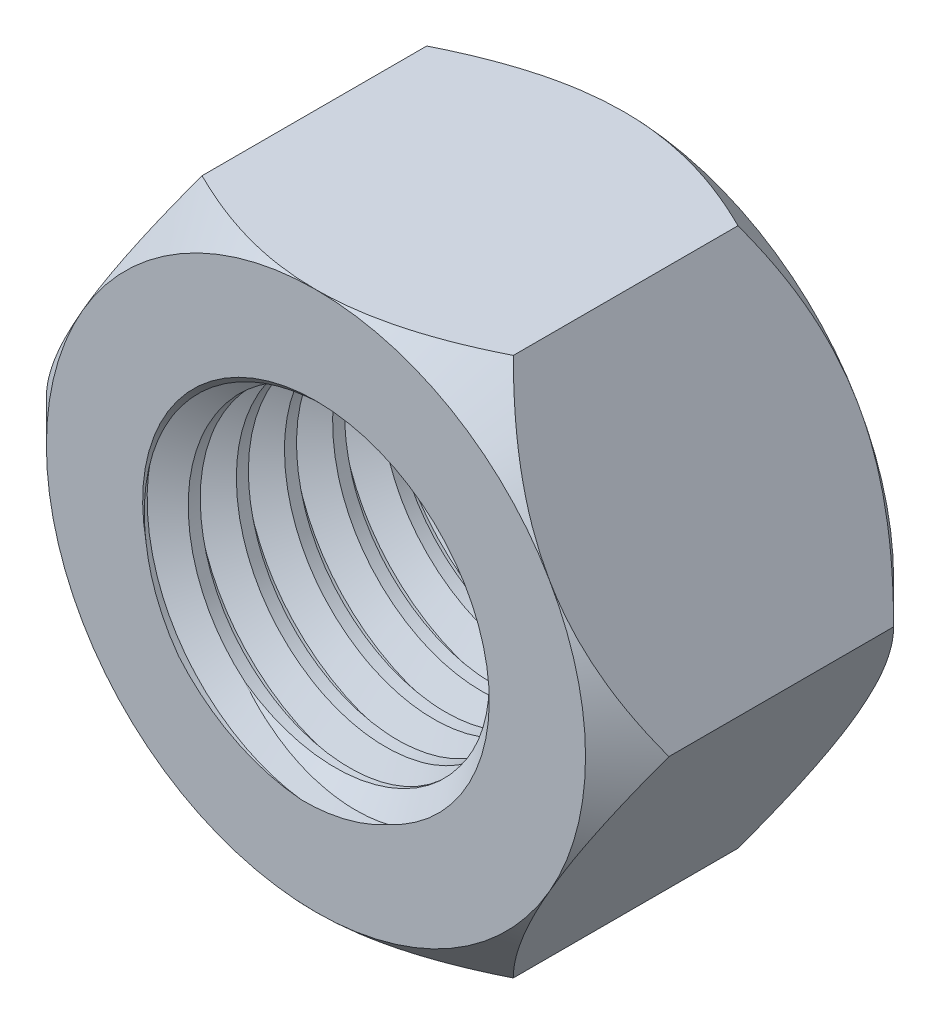
from build123d import *

# Parameters (mm, degrees)
BOSS_EXTRUDE1_DEPTH     = 4
SKETCH2_OUTSIDE_W       = 51.44
SKETCH2_OUTSIDE_H       = 49.274
SKETCH2_OUTSIDE_R       = 7
CUT_EXTRUDE1_DEPTH      = 14.354150416
CUT_EXTRUDE1_DRAFT      = -45
MIRROR1_COPY_1_SKETCH_W = 51.44
MIRROR1_COPY_1_SKETCH_H = 49.274
MIRROR1_COPY_1_SKETCH_R = 7
MIRROR1_COPY_1_DEPTH    = 14.354150416
MIRROR1_COPY_1_DRAFT    = -45
SKETCH3_R               = 4
CUT_EXTRUDE2_DEPTH      = 14.354150416
CHAMFER1_SIZE           = 0.5
THREAD1_PITCH           = 1.25


with BuildPart() as part:
    # Sketch1 → Boss-Extrude1 (new, symmetric)
    with BuildSketch(Plane.XY):
        Polygon((4.041451884, -7), (8.082903769, 0), (4.041451884, 7), (-4.041451884, 7), (-8.082903769, 0), (-4.041451884, -7), align=None)
    extrude(amount=BOSS_EXTRUDE1_DEPTH, both=True)


with BuildPart() as cut_extrude1_tool:
    # Sketch2 outside → Cut-Extrude1 (with draft: the straight prism first)
    with BuildSketch(Plane.XY.offset(4)):
        Rectangle(SKETCH2_OUTSIDE_W, SKETCH2_OUTSIDE_H)
        Circle(SKETCH2_OUTSIDE_R, mode=Mode.SUBTRACT)
    extrude(amount=-CUT_EXTRUDE1_DEPTH)
    # Cut-Extrude1: the draft: its side faces are tilted about the plane it starts from
    cut_extrude1_sides = [cut_extrude1_tool.faces().sort_by_distance(p)[0] for p in [
        (0, -24.637, -3.177075208),
        (25.72, 0, -3.177075208),
        (0, 24.637, -3.177075208),
        (-25.72, 0, -3.177075208),
        (-7, 0, -3.177075208),
    ]]
    draft(cut_extrude1_sides, Plane.XY.offset(4), CUT_EXTRUDE1_DRAFT)


with BuildPart() as part_1:
    add(part.part)

    # Cut-Extrude1: cut by cut_extrude1_tool
    add(cut_extrude1_tool.part, mode=Mode.SUBTRACT)


with BuildPart() as mirror1_copy_1_tool:
    # Mirror1 copy 1 sketch → Mirror1 copy 1 (with draft: the straight prism first)
    with BuildSketch(Plane(origin=(0, 0, -4), x_dir=(1, 0, 0), z_dir=(0, 0, -1))):
        Rectangle(MIRROR1_COPY_1_SKETCH_W, MIRROR1_COPY_1_SKETCH_H)
        Circle(MIRROR1_COPY_1_SKETCH_R, mode=Mode.SUBTRACT)
    extrude(amount=-MIRROR1_COPY_1_DEPTH)
    # Mirror1 copy 1: the draft: its side faces are tilted about the plane it starts from
    mirror1_copy_1_sides = [mirror1_copy_1_tool.faces().sort_by_distance(p)[0] for p in [
        (0, -24.637, 3.177075208),
        (25.72, 0, 3.177075208),
        (0, 24.637, 3.177075208),
        (-25.72, 0, 3.177075208),
        (-7, 0, 3.177075208),
    ]]
    draft(mirror1_copy_1_sides, Plane(origin=(0, 0, -4), x_dir=(1, 0, 0), z_dir=(0, 0, -1)), MIRROR1_COPY_1_DRAFT)


with BuildPart() as part_2:
    add(part_1.part)

    # Mirror1 copy 1: cut by mirror1_copy_1_tool
    add(mirror1_copy_1_tool.part, mode=Mode.SUBTRACT)

    # Sketch3 → Cut-Extrude2 (cut, through all)
    with BuildSketch(Plane.XY.offset(4)):
        Circle(SKETCH3_R)
    extrude(amount=-CUT_EXTRUDE2_DEPTH, mode=Mode.SUBTRACT)

    # Chamfer1
    chamfer1_edges = [part_2.edges().sort_by_distance(p)[0] for p in [
        (-4, 0, -4),
        (-4, 0, 4),
    ]]
    chamfer(chamfer1_edges, length=CHAMFER1_SIZE)

    # Thread1: the profile of Thread Profile1 profile screwed along a right-hand helix of 7.6 turns, 8 arcs to a turn; built about Z, then put on its axis
    thread1_z = Axis((0, 0, 0), (0, 0, 1))
    thread1_corners = [(3.9997, 0, -0.000173205), (4.676582344, 0, 0.390624998), (4.676582344, 0, 0.546874998), (3.9997, 0, 0.937673202)]
    with BuildLine(mode=Mode.PRIVATE) as thread1_profile:
        Line(thread1_corners[0], thread1_corners[1])
        Line(thread1_corners[1], thread1_corners[2])
        Line(thread1_corners[2], thread1_corners[3])
        Line(thread1_corners[3], thread1_corners[0])
    thread1_cap = Face(thread1_profile.wire())
    thread1_turn_angles = [0, 22.5, 45, 67.5, 90, 112.5, 135, 157.5, 180, 202.5, 225, 247.5, 270, 292.5, 315, 337.5, 360]
    thread1_turn_weights = [1, 0.9238795325112867, 1, 0.9238795325112867, 1, 0.9238795325112867, 1, 0.9238795325112867, 1, 0.9238795325112867, 1, 0.9238795325112867, 1, 0.9238795325112867, 1, 0.9238795325112867, 1]
    thread1_turn_rails = [Edge.make_bspline([Vector(p[0], p[1], 0).rotate(thread1_z, thread1_turn_angles[k]) / thread1_turn_weights[k] + Vector(0, 0, p[2] + THREAD1_PITCH * thread1_turn_angles[k] / 360) for k in range(17)], [0, 0, 0, 1, 1, 2, 2, 3, 3, 4, 4, 5, 5, 6, 6, 7, 7, 8, 8, 8], 2, thread1_turn_weights) for p in thread1_corners]
    thread1_turn_sides = [Face.make_surface_from_curves(thread1_turn_rails[p[0]], thread1_turn_rails[p[1]]) for p in [(0, 1), (1, 2), (2, 3), (3, 0)]]
    thread1_last_angles = [2520, 2542.5, 2565, 2587.5, 2610, 2632.5, 2655, 2677.5, 2700, 2718, 2736]
    thread1_last_weights = [1, 0.9238795325112867, 1, 0.9238795325112867, 1, 0.9238795325112867, 1, 0.9238795325112867, 1, 0.9510565162951535, 1]
    thread1_last_rails = [Edge.make_bspline([Vector(p[0], p[1], 0).rotate(thread1_z, thread1_last_angles[k]) / thread1_last_weights[k] + Vector(0, 0, p[2] + THREAD1_PITCH * thread1_last_angles[k] / 360) for k in range(11)], [0, 0, 0, 1, 1, 2, 2, 3, 3, 4, 4, 5, 5, 5], 2, thread1_last_weights) for p in thread1_corners]
    thread1_last_sides = [Face.make_surface_from_curves(thread1_last_rails[p[0]], thread1_last_rails[p[1]]) for p in [(0, 1), (1, 2), (2, 3), (3, 0)]]
    thread1 = Plane(origin=(0, 0, 5.5), x_dir=(-1, 0, 0), z_dir=(0, 0, -1)) * Solid(Shell([*[p.moved(Location((0, 0, THREAD1_PITCH * i))) for i in range(7) for p in thread1_turn_sides], *thread1_last_sides, thread1_cap, thread1_cap.rotate(thread1_z, 2736).moved(Location((0, 0, THREAD1_PITCH * 2736 / 360)))]))
    add(thread1, mode=Mode.SUBTRACT)


solid = part_2.part
